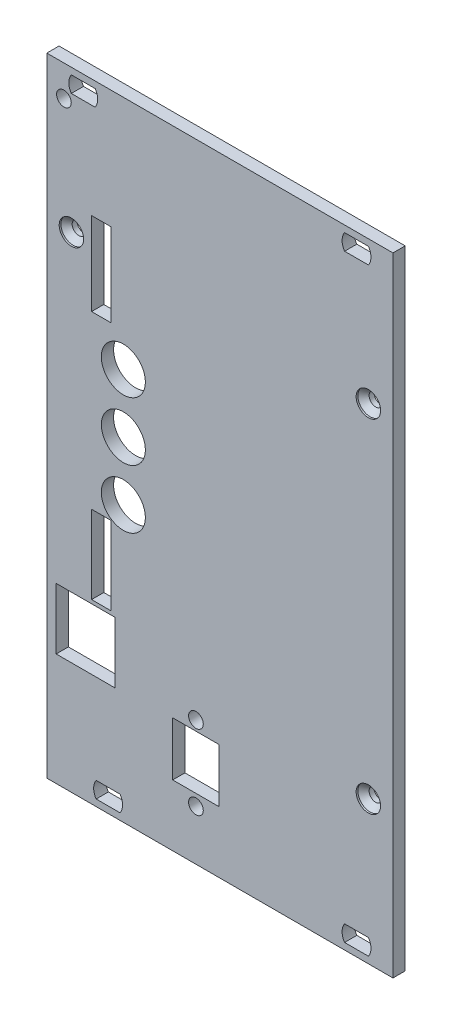
from build123d import *

# Parameters (mm, degrees)
SKETCH1_W                    = 70.78
SKETCH1_H                    = 128.4
BULK_DEPTH                   = 2.5
MOUNT_HOLE_NW_DEPTH          = 141.506579561
MOUNT_HOLES_NE_SE_COUNT      = 2
MOUNT_HOLES_NE_SE_PITCH      = 55.88
MOUNT_HOLES_NE_SE_COUNT_DIR2 = 2
MOUNT_HOLES_NE_SE_PITCH_DIR2 = 122.4
MOUNT_HOLE_SW_DEPTH          = 141.506579561
ALIGNMENT_HOLE_D             = 3
DRILL_HOLES_AT_2_COUNT       = 2
DRILL_HOLES_AT_2_PITCH       = 70
DRILL_HOLES_AT_3_COUNT       = 2
DRILL_HOLES_AT_3_PITCH       = 92.665626853
DRILL_HOLES_AT_4_COUNT       = 2
DRILL_HOLES_AT_4_PITCH       = 60.72
SKETCH9_W                    = 12
SKETCH9_H                    = 12.5
USB_DEPTH                    = 141.506579561
MCXX_DEPTH                   = 141.506579561
SKETCH12_R                   = 4.5
SELECTOR_1_DEPTH             = 141.506579561
COPY_SELECTOR_COUNT          = 3
COPY_SELECTOR_PITCH          = 12
MMCX_2_DEPTH                 = 141.506579561
SKETCH25_R                   = 1.5
SKETCH25_W                   = 9.5
SKETCH25_H                   = 11
BARREL_JACK_DEPTH            = 141.506579561


with BuildPart() as part:
    # Sketch1 → Bulk (new body)
    with BuildSketch(Plane.XY.offset(2.5)):
        with Locations((27.94, 61.2)):
            Rectangle(SKETCH1_W, SKETCH1_H)
    extrude(amount=-BULK_DEPTH)

    # Sketch2 → Mount hole NW (cut, through all)
    with BuildSketch(Plane.XY.offset(2.5)):
        with BuildLine():
            Line((2.445403852, 124.05), (-2.445403852, 124.05))
            ThreePointArc((-2.445403852, 124.05), (-2.95, 122.4), (-2.445403852, 120.75))
            Line((-2.445403852, 120.75), (2.445403852, 120.75))
            ThreePointArc((2.445403852, 120.75), (2.95, 122.4), (2.445403852, 124.05))
        make_face()
    mount_hole_nw = extrude(amount=-MOUNT_HOLE_NW_DEPTH, mode=Mode.SUBTRACT)

    # Mount holes NE SE: Mount hole NW 2 × 2, 1 skipped
    with Locations(*[(i * MOUNT_HOLES_NE_SE_PITCH, -j * MOUNT_HOLES_NE_SE_PITCH_DIR2, 0) for i in range(MOUNT_HOLES_NE_SE_COUNT) for j in range(MOUNT_HOLES_NE_SE_COUNT_DIR2) if (i, j) not in ((0, 0), (0, 1))]):
        add(mount_hole_nw, mode=Mode.SUBTRACT)

    # Sketch3 → Mount hole SW (cut, through all)
    with BuildSketch(Plane.XY.offset(2.5)):
        with BuildLine():
            Line((7.525403852, 1.65), (2.634596148, 1.65))
            ThreePointArc((2.634596148, 1.65), (2.13, 0), (2.634596148, -1.65))
            Line((2.634596148, -1.65), (7.525403852, -1.65))
            ThreePointArc((7.525403852, -1.65), (8.03, 0), (7.525403852, 1.65))
        make_face()
    extrude(amount=-MOUNT_HOLE_SW_DEPTH, mode=Mode.SUBTRACT)

    # Alignment hole (through all)
    with Locations(Plane.XY.offset(2.5)):
        with Locations((-3.95, 119.1)):
            Hole(ALIGNMENT_HOLE_D / 2)

    # Sketch7 → Drill holes (revolve, cut)
    with BuildSketch(Plane(origin=(-2.42, 26.2, 2.5), x_dir=(0, -1, 0), z_dir=(1, 0, 0))):
        Polygon((0, 0), (0, 2.5), (1.35, 2.5), (1.35, 1.5), (2.5, 0.35), (2.5, 0), align=None)
    drill_holes = revolve(axis=Axis((-2.42, 26.2, 8.85), (0, 0, -1)), mode=Mode.SUBTRACT)

    # Drill holes at 2: Drill holes ×2
    with Locations(*[(0, i * DRILL_HOLES_AT_2_PITCH, 0) for i in range(1, DRILL_HOLES_AT_2_COUNT)]):
        add(drill_holes, mode=Mode.SUBTRACT)

    # Drill holes at 3: Drill holes ×2
    with Locations(*[Vector(0.6552591512334259, 0.7554041598540813, 0) * (i * DRILL_HOLES_AT_3_PITCH) for i in range(1, DRILL_HOLES_AT_3_COUNT)]):
        add(drill_holes, mode=Mode.SUBTRACT)

    # Drill holes at 4: Drill holes ×2
    with Locations(*[(i * DRILL_HOLES_AT_4_PITCH, 0, 0) for i in range(1, DRILL_HOLES_AT_4_COUNT)]):
        add(drill_holes, mode=Mode.SUBTRACT)

    # Sketch9 → USB (cut, through all)
    with BuildSketch(Plane.XY.offset(2.5)):
        with Locations((0.465, 26.2)):
            Rectangle(SKETCH9_W, SKETCH9_H)
    extrude(amount=-USB_DEPTH, mode=Mode.SUBTRACT)

    # Sketch10 → MCXX (cut, through all)
    with BuildSketch(Plane.XY.offset(2.5)):
        Polygon((1.7, 49.2), (1.7, 37.2), (1.7, 33.2), (5.7, 33.2), (5.7, 37.2), (5.7, 49.2), align=None)
    extrude(amount=-MCXX_DEPTH, mode=Mode.SUBTRACT)

    # Sketch12 → Selector 1 (cut, through all)
    with BuildSketch(Plane.XY.offset(2.5)):
        with Locations((8.2, 53.2)):
            Circle(SKETCH12_R)
    selector_1 = extrude(amount=-SELECTOR_1_DEPTH, mode=Mode.SUBTRACT)

    # Copy selector: Selector 1 ×3
    with Locations(*[(0, i * COPY_SELECTOR_PITCH, 0) for i in range(1, COPY_SELECTOR_COUNT)]):
        add(selector_1, mode=Mode.SUBTRACT)

    # Sketch27 → MMCX 2 (cut, through all)
    with BuildSketch(Plane.XY.offset(2.5)):
        Polygon((1.7, 101.2), (1.7, 88.2), (1.7, 84.2), (5.7, 84.2), (5.7, 88.2), (5.7, 101.2), align=None)
    extrude(amount=-MMCX_2_DEPTH, mode=Mode.SUBTRACT)

    # Sketch25 → Barrel Jack (cut, through all)
    with BuildSketch(Plane.XY.offset(2.5)):
        with Locations((23.043898983, 22.557406324)):
            Circle(SKETCH25_R)
        with Locations((23.043898983, 7.257406324)):
            Circle(SKETCH25_R)
        with Locations((23.043898983, 15.057406324)):
            Rectangle(SKETCH25_W, SKETCH25_H)
    extrude(amount=-BARREL_JACK_DEPTH, mode=Mode.SUBTRACT)


solid = part.part
